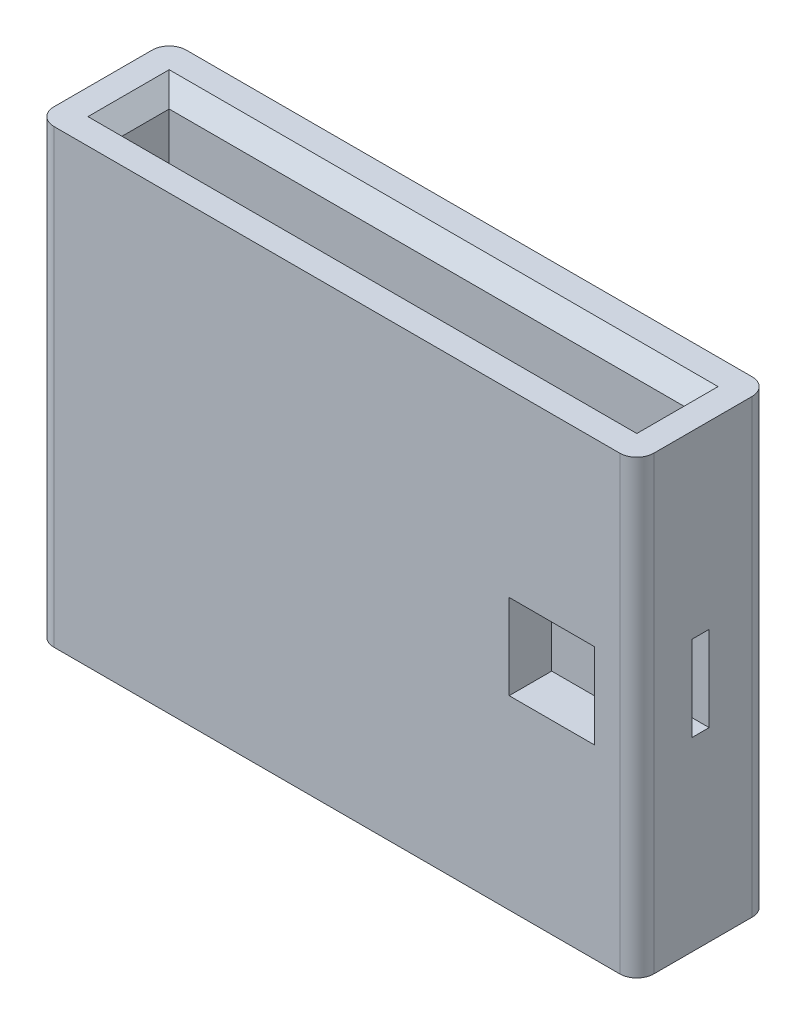
from build123d import *

# Parameters (mm, degrees)
SKETCH1_W               = 70.5
SKETCH1_H               = 15.55
SKETCH1_W_2             = 60.5
SKETCH1_H_2             = 5.55
EXTRUDE_THIN1_DEPTH     = 48
SKETCH2_W               = 70.5
SKETCH2_H               = 15.55
BOSS_EXTRUDE1_DEPTH     = 5
SKETCH4_W               = 10
SKETCH4_H               = 10
EXCITATION_CUTOUT_DEPTH = 5
EMISSION_CUTOUT_REACH   = 87.643
SKETCH6_W               = 2
SKETCH6_H               = 10
FILLET1_R               = 2
CHAMFER1_SIZE           = 2


with BuildPart() as part:
    # Sketch1 → Extrude-Thin1 (new body)
    with BuildSketch(Plane(origin=(0, 0, 0), x_dir=(1, 0, 0), z_dir=(0, 1, 0))):
        Rectangle(SKETCH1_W, SKETCH1_H)
        Rectangle(SKETCH1_W_2, SKETCH1_H_2, mode=Mode.SUBTRACT)
    extrude(amount=EXTRUDE_THIN1_DEPTH)

    # Sketch2 → Boss-Extrude1 (add)
    with BuildSketch(Plane.XZ):
        Rectangle(SKETCH2_W, SKETCH2_H)
    extrude(amount=BOSS_EXTRUDE1_DEPTH)

    # Sketch4 → Excitation Cutout (cut)
    with BuildSketch(Plane.XY.offset(7.775)):
        with Locations((25.25, 21.82)):
            Rectangle(SKETCH4_W, SKETCH4_H)
    extrude(amount=-EXCITATION_CUTOUT_DEPTH, mode=Mode.SUBTRACT)

    # Sketch6 → Emission Cutout (cut, up to next)
    with BuildSketch(Plane(origin=(35.25, 0, 0), x_dir=(0, 0, -1), z_dir=(1, 0, 0)), mode=Mode.PRIVATE) as emission_cutout_sk1:
        with Locations((-0.275, 21.82)):
            Rectangle(SKETCH6_W, SKETCH6_H)
    emission_cutout_tool1 = extrude(emission_cutout_sk1.sketch, amount=-EMISSION_CUTOUT_REACH, mode=Mode.PRIVATE) & part.part
    add(emission_cutout_tool1.solids().sort_by_distance((35.25, 21.82, 0.275))[0], mode=Mode.SUBTRACT)

    # Fillet1
    fillet1_edges = [part.edges().sort_by_distance(p)[0] for p in [
        (-35.25, 21.5, 7.775),
        (-35.25, 21.5, -7.775),
        (35.25, 21.5, -7.775),
        (35.25, 21.5, 7.775),
    ]]
    fillet(fillet1_edges, radius=FILLET1_R)

    # Chamfer1
    chamfer1_edges = [part.edges().sort_by_distance(p)[0] for p in [
        (0, 48, -2.775),
        (30.25, 48, 0),
        (-30.25, 48, 0),
        (0, 48, 2.775),
    ]]
    chamfer(chamfer1_edges, length=CHAMFER1_SIZE)


solid = part.part
